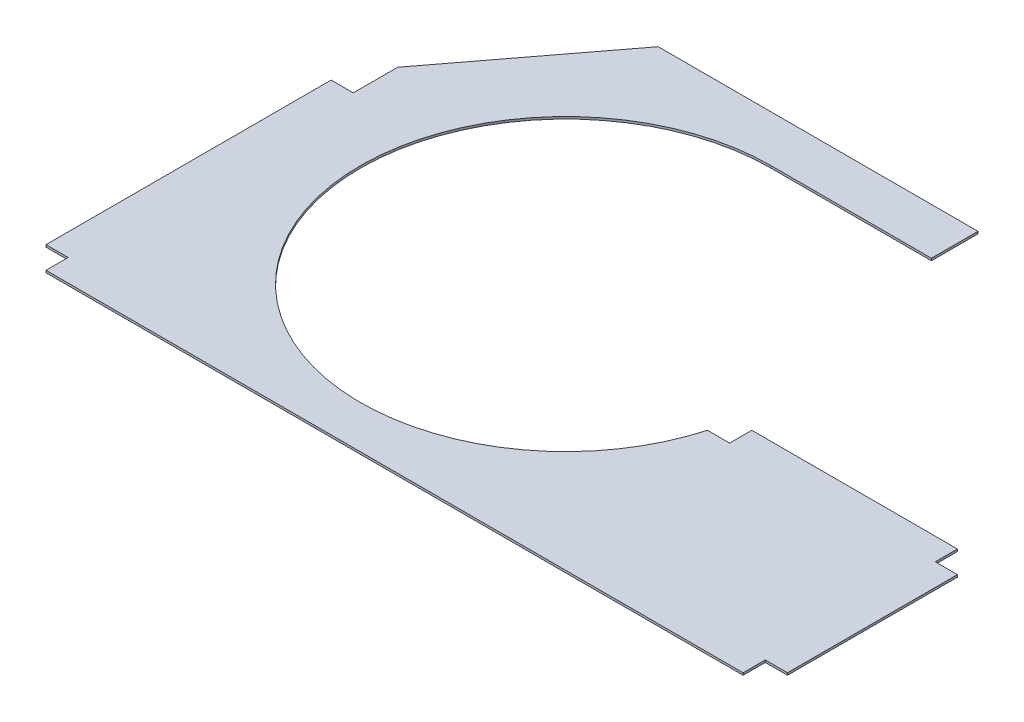
from build123d import *

# Parameters (mm, degrees)
BOSS_EXTRUDE1_DEPTH = 2


with BuildPart() as part:
    # Sketch1 → Boss-Extrude1 (new body)
    with BuildSketch(Plane(origin=(0, 0, 0), x_dir=(1, 0, 0), z_dir=(0, 1, 0))):
        with BuildLine():
            Line((0, 0), (20, 0))
            Line((20, 0), (20, -20))
            Line((20, -20), (648.38, -20))
            Line((648.38, -20), (648.38, 0))
            Line((648.38, 0), (668.38, 0))
            Line((668.38, 0), (668.38, 153.21))
            Line((668.38, 153.21), (648.38, 153.21))
            Line((648.38, 153.21), (648.38, 173.21))
            Line((648.38, 173.21), (463.044943633, 173.21))
            Line((463.044943633, 173.21), (463.044943633, 153.21))
            Line((463.044943633, 153.21), (443.044943633, 153.21))
            ThreePointArc((443.044943633, 153.21), (117.485371312, 91.815127637), (265, 388.45935867))
            Line((265, 388.45935867), (409.658335612, 388.45935867))
            Line((409.658335612, 388.45935867), (409.658335612, 430.45935867))
            Line((409.658335612, 430.45935867), (121.389532072, 430.45935867))
            Line((121.389532072, 430.45935867), (20, 297))
            Line((20, 297), (20, 257))
            Line((20, 257), (0, 257))
            Line((0, 257), (0, 0))
        make_face()
    extrude(amount=BOSS_EXTRUDE1_DEPTH)


solid = part.part
